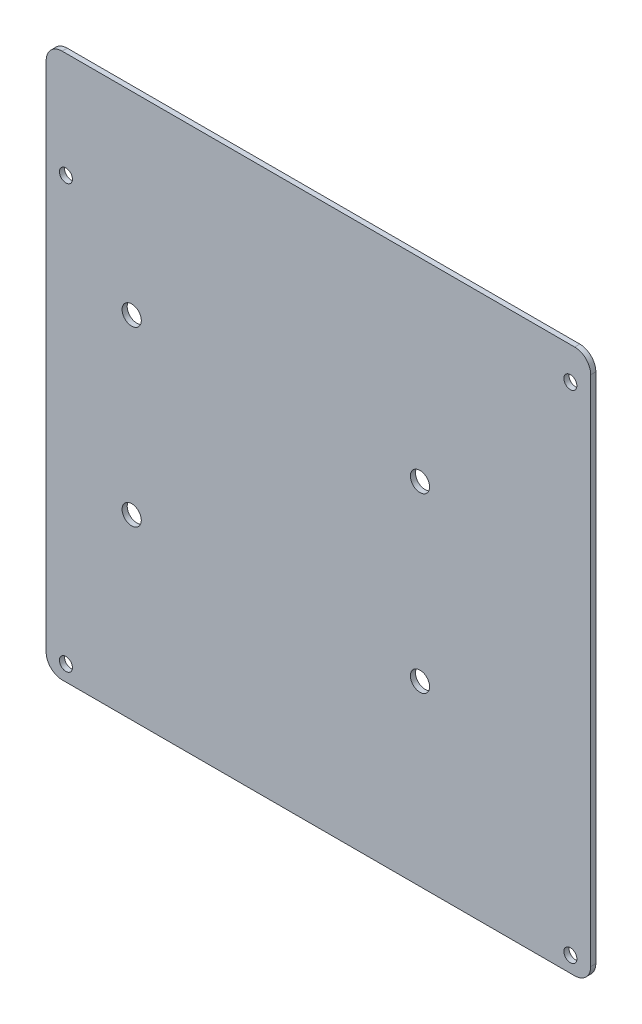
from build123d import *

# Parameters (mm, degrees)
SKETCH1_W            = 170
SKETCH1_H            = 170
BASE_DEPTH           = 1.6
ROUNDING_CORNERS_R   = 5
SKETCH2_R            = 2.03
MOUNTING_HOLES_DEPTH = 1.6
SKETCH4_R            = 3
CUT_EXTRUDE2_DEPTH   = 1.6


with BuildPart() as part:
    # Sketch1 → Base (new body)
    with BuildSketch(Plane.XY):
        Rectangle(SKETCH1_W, SKETCH1_H)
    extrude(amount=BASE_DEPTH)

    # Rounding corners
    rounding_corners_edges = [part.edges().sort_by_distance(p)[0] for p in [
        (-85, 85, 0.8),
        (85, 85, 0.8),
        (85, -85, 0.8),
        (-85, -85, 0.8),
    ]]
    fillet(rounding_corners_edges, radius=ROUNDING_CORNERS_R)

    # Sketch2 → Mounting holes (cut)
    with BuildSketch(Plane.XY.offset(1.6)):
        with Locations((-78.83, 51.98)):
            Circle(SKETCH2_R)
        with Locations((78.65, 74.84)):
            Circle(SKETCH2_R)
        with Locations((-78.83, -80.1)):
            Circle(SKETCH2_R)
        with Locations((78.65, -80.1)):
            Circle(SKETCH2_R)
    extrude(amount=-MOUNTING_HOLES_DEPTH, mode=Mode.SUBTRACT)

    # Sketch4 → Cut-Extrude2 (cut)
    with BuildSketch(Plane.XY.offset(1.6)):
        with Locations((-58.3, 24.5)):
            Circle(SKETCH4_R)
        with Locations((31.7, 24.5)):
            Circle(SKETCH4_R)
        with Locations((31.7, -29.5)):
            Circle(SKETCH4_R)
        with Locations((-58.3, -29.5)):
            Circle(SKETCH4_R)
    extrude(amount=-CUT_EXTRUDE2_DEPTH, mode=Mode.SUBTRACT)


solid = part.part
